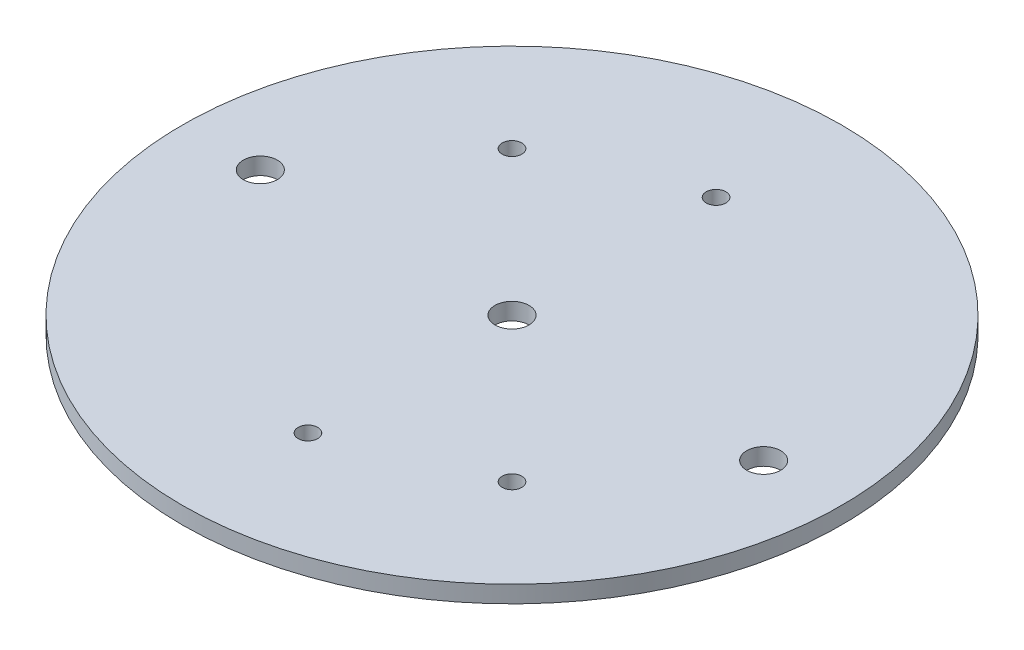
from build123d import *

# Parameters (mm, degrees)
SKETCH2_R           = 61.5315
SKETCH2_R_2         = 3.175
SKETCH2_R_3         = 1.8288
BOSS_EXTRUDE1_DEPTH = 3.175


with BuildPart() as part:
    # Sketch2 → Boss-Extrude1 (new body)
    with BuildSketch(Plane(origin=(0, 0, 0), x_dir=(1, 0, 0), z_dir=(0, 1, 0))):
        Circle(SKETCH2_R)
        with Locations((-46.99, 0)):
            Circle(SKETCH2_R_2, mode=Mode.SUBTRACT)
        with Locations((46.99, 0)):
            Circle(SKETCH2_R_2, mode=Mode.SUBTRACT)
        Circle(SKETCH2_R_2, mode=Mode.SUBTRACT)
        with Locations((0, 38.1)):
            Circle(SKETCH2_R_3, mode=Mode.SUBTRACT)
        with Locations((0, -38.1)):
            Circle(SKETCH2_R_3, mode=Mode.SUBTRACT)
        with Locations((-26.940768363, 26.940768363)):
            Circle(SKETCH2_R_3, mode=Mode.SUBTRACT)
        with Locations((26.940768363, -26.940768363)):
            Circle(SKETCH2_R_3, mode=Mode.SUBTRACT)
    extrude(amount=BOSS_EXTRUDE1_DEPTH)


solid = part.part
